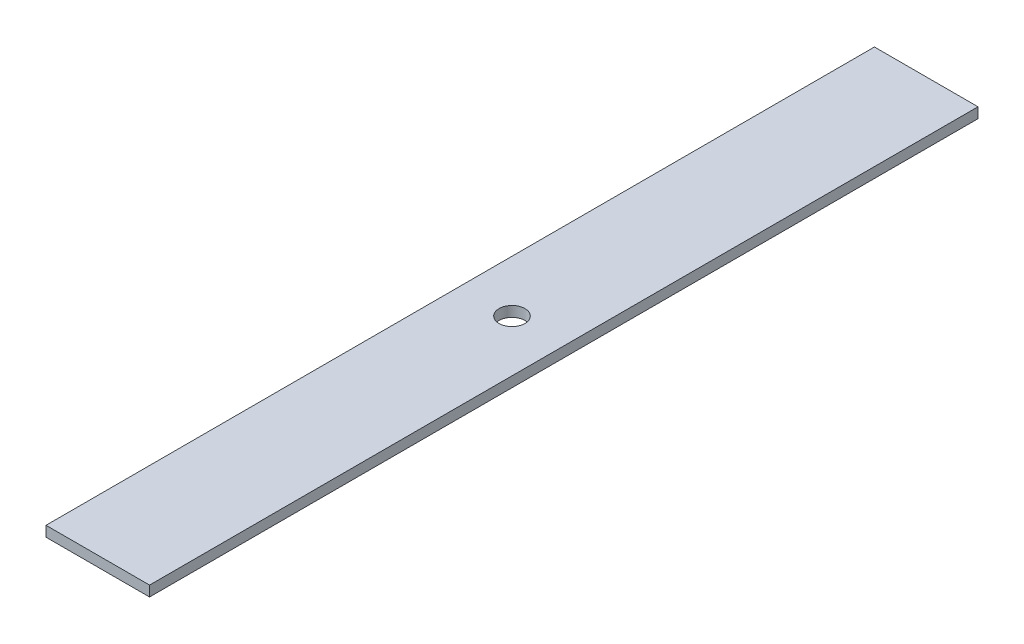
from build123d import *

# Parameters (mm, degrees)
SKETCH_W            = 25.4
SKETCH_H            = 203.2
SKETCH_R            = 3.175
BOSS_EXTRUDE2_DEPTH = 2.54


with BuildPart() as part:
    # sketch → Boss-Extrude2 (new body)
    with BuildSketch(Plane(origin=(0, 0, 0), x_dir=(1, 0, 0), z_dir=(0, 1, 0))):
        with Locations((12.7, 101.6)):
            Rectangle(SKETCH_W, SKETCH_H)
        with Locations((12.7, 101.6)):
            Circle(SKETCH_R, mode=Mode.SUBTRACT)
    extrude(amount=BOSS_EXTRUDE2_DEPTH)


solid = part.part
